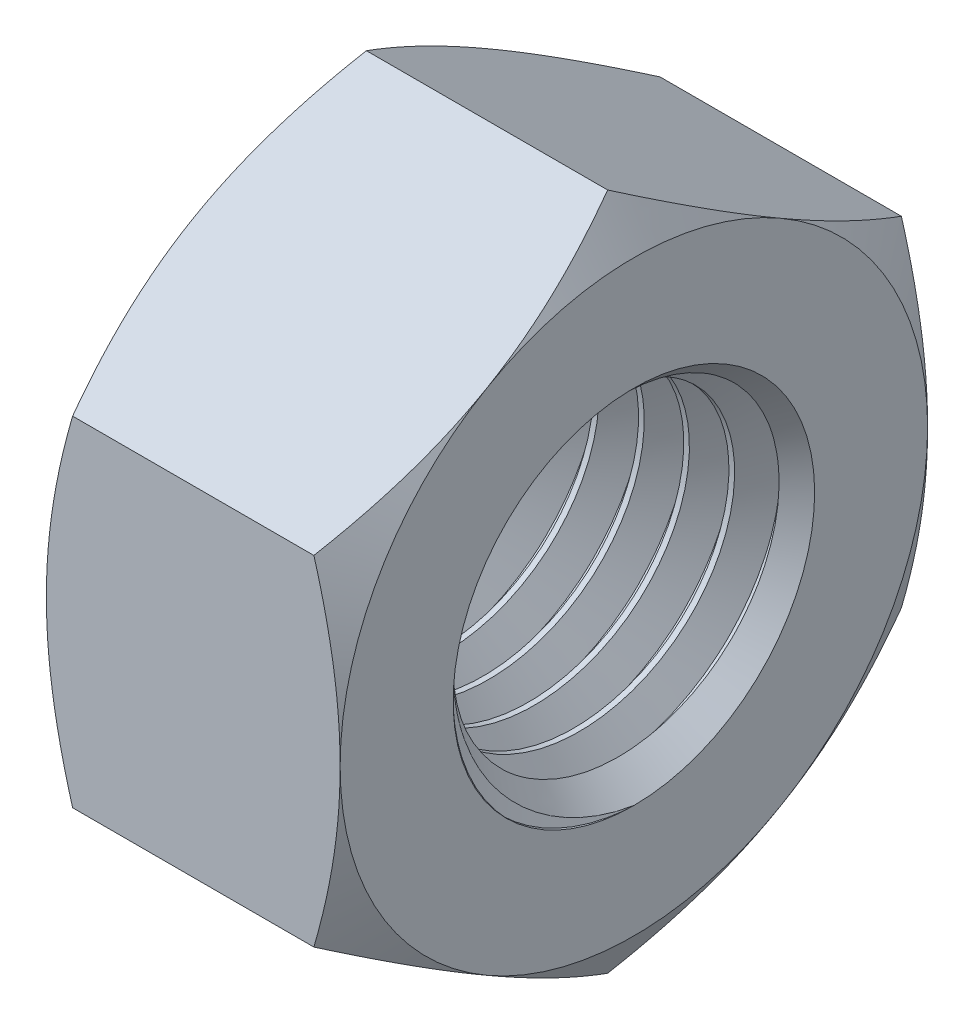
from build123d import *

# Parameters (mm, degrees)
BOSS_EXTRUDE1_DEPTH     = 3.25
CUT_EXTRUDE1_DEPTH      = 6.5
CUT_EXTRUDE1_DEPTH_BACK = 12.867322079
SKETCH2_R               = 4
SKETCH11_OUTSIDE_W      = 63.752
SKETCH11_OUTSIDE_H      = 65.764
SKETCH11_OUTSIDE_R      = 6.5
CUT_EXTRUDE7_DEPTH      = 12.867322079
CUT_EXTRUDE7_DRAFT      = -60
MIRROR4_COPY_1_SKETCH_W = 63.752
MIRROR4_COPY_1_SKETCH_H = 65.764
MIRROR4_COPY_1_SKETCH_R = 6.5
MIRROR4_COPY_1_DEPTH    = 12.867322079
MIRROR4_COPY_1_DRAFT    = -60
SWEEP1_PITCH            = 1
CUT_EXTRUDE2_DEPTH      = 13.462064945


with BuildPart() as part:
    # Sketch1 → Boss-Extrude1 (new, symmetric)
    with BuildSketch(Plane(origin=(0, 0, 0), x_dir=(0, 0, -1), z_dir=(1, 0, 0))):
        Polygon((-6.5, -3.75277675), (0, -7.505553499), (6.5, -3.75277675), (6.5, 3.75277675), (0, 7.505553499), (-6.5, 3.75277675), align=None)
    extrude(amount=BOSS_EXTRUDE1_DEPTH, both=True)

    # Sketch2 → Cut-Extrude1 (cut, two sides: drawn at the far end of the back side and taken through both)
    with BuildSketch(Plane(origin=(-3.25, 0, 0), x_dir=(0, 0, -1), z_dir=(1, 0, 0)).offset(-CUT_EXTRUDE1_DEPTH_BACK)):
        Circle(SKETCH2_R)
    extrude(amount=CUT_EXTRUDE1_DEPTH + CUT_EXTRUDE1_DEPTH_BACK, mode=Mode.SUBTRACT)


with BuildPart() as cut_extrude7_tool:
    # Sketch11 outside → Cut-Extrude7 (with draft: the straight prism first)
    with BuildSketch(Plane.ZY.offset(3.25)):
        Rectangle(SKETCH11_OUTSIDE_W, SKETCH11_OUTSIDE_H)
        Circle(SKETCH11_OUTSIDE_R, mode=Mode.SUBTRACT)
    extrude(amount=-CUT_EXTRUDE7_DEPTH)
    # Cut-Extrude7: the draft: its side faces are tilted about the plane it starts from
    cut_extrude7_sides = [cut_extrude7_tool.faces().sort_by_distance(p)[0] for p in [
        (3.18366104, -32.882, 0),
        (3.18366104, 0, 31.876),
        (3.18366104, 32.882, 0),
        (3.18366104, 0, -31.876),
        (3.18366104, 0, -6.5),
    ]]
    draft(cut_extrude7_sides, Plane.ZY.offset(3.25), CUT_EXTRUDE7_DRAFT)


with BuildPart() as part_1:
    add(part.part)

    # Cut-Extrude7: cut by cut_extrude7_tool
    add(cut_extrude7_tool.part, mode=Mode.SUBTRACT)


with BuildPart() as mirror4_copy_1_tool:
    # Mirror4 copy 1 sketch → Mirror4 copy 1 (with draft: the straight prism first)
    with BuildSketch(Plane(origin=(3.25, 0, 0), x_dir=(0, 0, 1), z_dir=(1, 0, 0))):
        Rectangle(MIRROR4_COPY_1_SKETCH_W, MIRROR4_COPY_1_SKETCH_H)
        Circle(MIRROR4_COPY_1_SKETCH_R, mode=Mode.SUBTRACT)
    extrude(amount=-MIRROR4_COPY_1_DEPTH)
    # Mirror4 copy 1: the draft: its side faces are tilted about the plane it starts from
    mirror4_copy_1_sides = [mirror4_copy_1_tool.faces().sort_by_distance(p)[0] for p in [
        (-3.18366104, -32.882, 0),
        (-3.18366104, 0, 31.876),
        (-3.18366104, 32.882, 0),
        (-3.18366104, 0, -31.876),
        (-3.18366104, 0, -6.5),
    ]]
    draft(mirror4_copy_1_sides, Plane(origin=(3.25, 0, 0), x_dir=(0, 0, 1), z_dir=(1, 0, 0)), MIRROR4_COPY_1_DRAFT)


with BuildPart() as part_2:
    add(part_1.part)

    # Mirror4 copy 1: cut by mirror4_copy_1_tool
    add(mirror4_copy_1_tool.part, mode=Mode.SUBTRACT)

    # Sweep1: the profile of Sketch6 screwed along a right-hand helix of 7.5 turns, 8 arcs to a turn; built about Z, then put on its axis
    sweep1_z = Axis((0, 0, 0), (0, 0, 1))
    sweep1_corners = [(4.054126588, 0, 0.03125), (3.350480947, 0, -0.375), (3.350480947, 0, -0.5), (4.054126588, 0, -0.90625)]
    with BuildLine(mode=Mode.PRIVATE) as sweep1_profile:
        Line(sweep1_corners[0], sweep1_corners[1])
        Line(sweep1_corners[1], sweep1_corners[2])
        Line(sweep1_corners[2], sweep1_corners[3])
        Line(sweep1_corners[3], sweep1_corners[0])
    sweep1_cap = Face(sweep1_profile.wire())
    sweep1_turn_angles = [0, 22.5, 45, 67.5, 90, 112.5, 135, 157.5, 180, 202.5, 225, 247.5, 270, 292.5, 315, 337.5, 360]
    sweep1_turn_weights = [1, 0.9238795325112867, 1, 0.9238795325112867, 1, 0.9238795325112867, 1, 0.9238795325112867, 1, 0.9238795325112867, 1, 0.9238795325112867, 1, 0.9238795325112867, 1, 0.9238795325112867, 1]
    sweep1_turn_rails = [Edge.make_bspline([Vector(p[0], p[1], 0).rotate(sweep1_z, sweep1_turn_angles[k]) / sweep1_turn_weights[k] + Vector(0, 0, p[2] + SWEEP1_PITCH * sweep1_turn_angles[k] / 360) for k in range(17)], [0, 0, 0, 1, 1, 2, 2, 3, 3, 4, 4, 5, 5, 6, 6, 7, 7, 8, 8, 8], 2, sweep1_turn_weights) for p in sweep1_corners]
    sweep1_turn_sides = [Face.make_surface_from_curves(sweep1_turn_rails[p[0]], sweep1_turn_rails[p[1]]) for p in [(0, 1), (1, 2), (2, 3), (3, 0)]]
    sweep1_last_angles = [2520, 2542.5, 2565, 2587.5, 2610, 2632.5, 2655, 2677.5, 2700]
    sweep1_last_weights = [1, 0.9238795325112867, 1, 0.9238795325112867, 1, 0.9238795325112867, 1, 0.9238795325112822, 1]
    sweep1_last_rails = [Edge.make_bspline([Vector(p[0], p[1], 0).rotate(sweep1_z, sweep1_last_angles[k]) / sweep1_last_weights[k] + Vector(0, 0, p[2] + SWEEP1_PITCH * sweep1_last_angles[k] / 360) for k in range(9)], [0, 0, 0, 1, 1, 2, 2, 3, 3, 4, 4, 4], 2, sweep1_last_weights) for p in sweep1_corners]
    sweep1_last_sides = [Face.make_surface_from_curves(sweep1_last_rails[p[0]], sweep1_last_rails[p[1]]) for p in [(0, 1), (1, 2), (2, 3), (3, 0)]]
    sweep1 = Plane(origin=(-3.25, 0, 0), x_dir=(0, 1, 0), z_dir=(1, 0, 0)) * Solid(Shell([*[p.moved(Location((0, 0, SWEEP1_PITCH * i))) for i in range(7) for p in sweep1_turn_sides], *sweep1_last_sides, sweep1_cap, sweep1_cap.rotate(sweep1_z, 2700).moved(Location((0, 0, SWEEP1_PITCH * 2700 / 360)))]))
    add(sweep1)

    # Sketch7 → Cut-Extrude2 (cut, through all)
    with BuildSketch(Plane.ZY.offset(3.25)):
        with BuildLine():
            ThreePointArc((-3.25, 5.629165125), (-5.629165125, 3.25), (-6.5, 0))
            ThreePointArc((-6.5, 0), (-5.629165125, -3.25), (-3.25, -5.629165125))
            ThreePointArc((-3.25, -5.629165125), (0, -6.5), (3.25, -5.629165125))
            ThreePointArc((3.25, -5.629165125), (5.629165125, -3.25), (6.5, 0))
            ThreePointArc((6.5, 0), (5.629165125, 3.25), (3.25, 5.629165125))
            ThreePointArc((3.25, 5.629165125), (0, 6.5), (-3.25, 5.629165125))
        make_face()
    cut_extrude2 = extrude(amount=CUT_EXTRUDE2_DEPTH, mode=Mode.SUBTRACT)

    # Cut-Extrude6 cone 1 section (through the dimple's axis) → Cut-Extrude6 (revolve, cut)
    with BuildSketch(Plane(origin=(-3.25, 0, 0), x_dir=(0, 0, 1), z_dir=(0, 1, 0))):
        Polygon((0, 0), (4, 0), (0, 4), align=None)
    cut_extrude6 = revolve(axis=Axis((-3.25, 0, 0), (1, 0, 0)), mode=Mode.SUBTRACT)

    # Mirror1: Cut-Extrude2, Cut-Extrude6 across plane
    add(cut_extrude2.mirror(Plane(origin=(0, 0, 0), x_dir=(0, 0, 1), z_dir=(1, 0, 0))), mode=Mode.SUBTRACT)
    add(cut_extrude6.mirror(Plane(origin=(0, 0, 0), x_dir=(0, 0, 1), z_dir=(1, 0, 0))), mode=Mode.SUBTRACT)


solid = part_2.part
